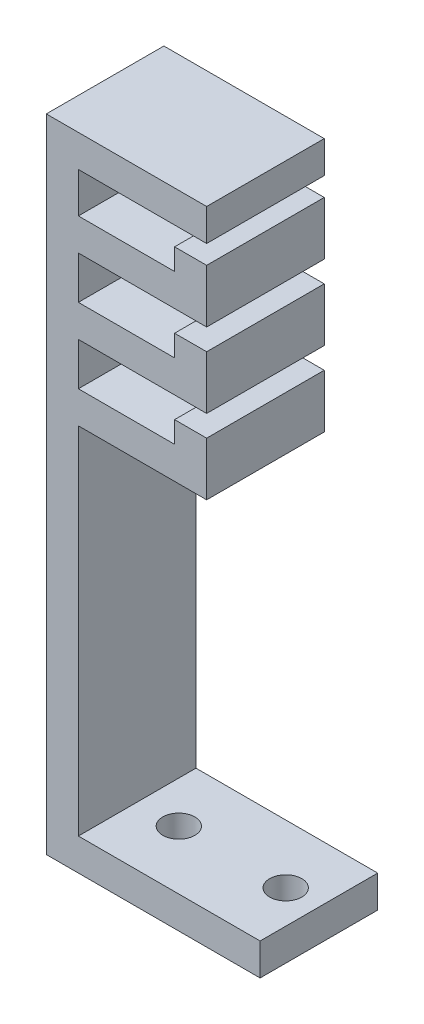
from build123d import *

# Parameters (mm, degrees)
BOSS_EXTRUDE2_DEPTH = 11
SKETCH4_R           = 1.5
CUT_EXTRUDE1_DEPTH  = 11


with BuildPart() as part:
    # Sketch1 → Boss-Extrude2 (new body)
    with BuildSketch(Plane.XY):
        Polygon((0, 0), (-20, 0), (-20, 60), (-17, 60), (-5, 60), (-5, 57), (-17, 57), (-17, 53.232919745), (-8, 53.232919745), (-8, 55.232919745), (-5, 55.232919745), (-5, 50.232919745), (-17, 50.232919745), (-17, 46.232919745), (-8, 46.232919745), (-8, 48.232919745), (-5, 48.232919745), (-5, 43.232919745), (-17, 43.232919745), (-17, 39.232919745), (-8, 39.232919745), (-8, 41.232919745), (-5, 41.232919745), (-5, 36.232919745), (-17, 36.232919745), (-17, 3), (0, 3), align=None)
    extrude(amount=BOSS_EXTRUDE2_DEPTH)

    # Sketch4 → Cut-Extrude1 (cut)
    with BuildSketch(Plane.XZ):
        with Locations((-3.103292827, 5.5)):
            Circle(SKETCH4_R)
        with Locations((-13.103292827, 5.5)):
            Circle(SKETCH4_R)
    extrude(amount=-CUT_EXTRUDE1_DEPTH, mode=Mode.SUBTRACT)


solid = part.part
